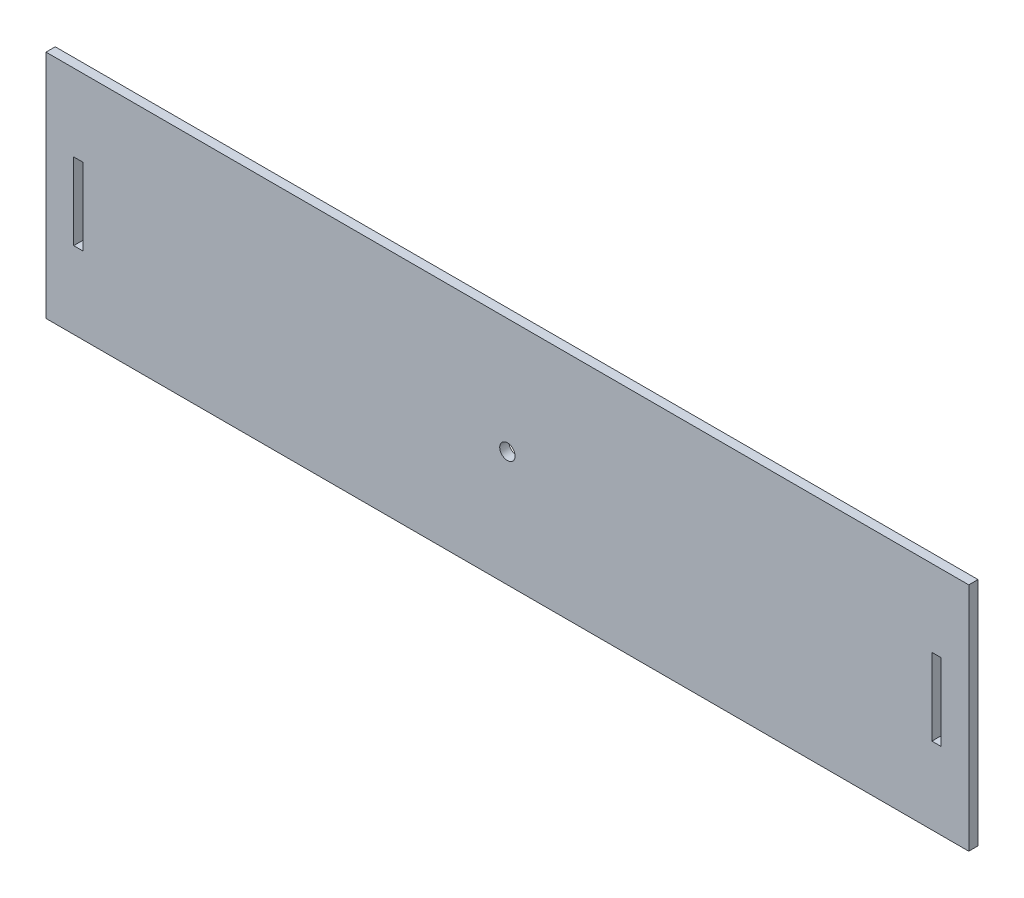
from build123d import *

# Parameters (mm, degrees)
SKETCH1_R           = 5
SKETCH1_W           = 6
SKETCH1_H           = 50
BOSS_EXTRUDE1_DEPTH = 6


with BuildPart() as part:
    # Sketch1 → Boss-Extrude1 (new body)
    with BuildSketch(Plane.XY):
        Polygon((0, 0), (600, 0), (600, -150), (307, -150), (257, -150), (0, -150), align=None)
        with Locations((300, -75)):
            Circle(SKETCH1_R, mode=Mode.SUBTRACT)
        with Locations((579, -75)):
            Rectangle(SKETCH1_W, SKETCH1_H, mode=Mode.SUBTRACT)
        with Locations((21, -75)):
            Rectangle(SKETCH1_W, SKETCH1_H, mode=Mode.SUBTRACT)
    extrude(amount=BOSS_EXTRUDE1_DEPTH)


solid = part.part
